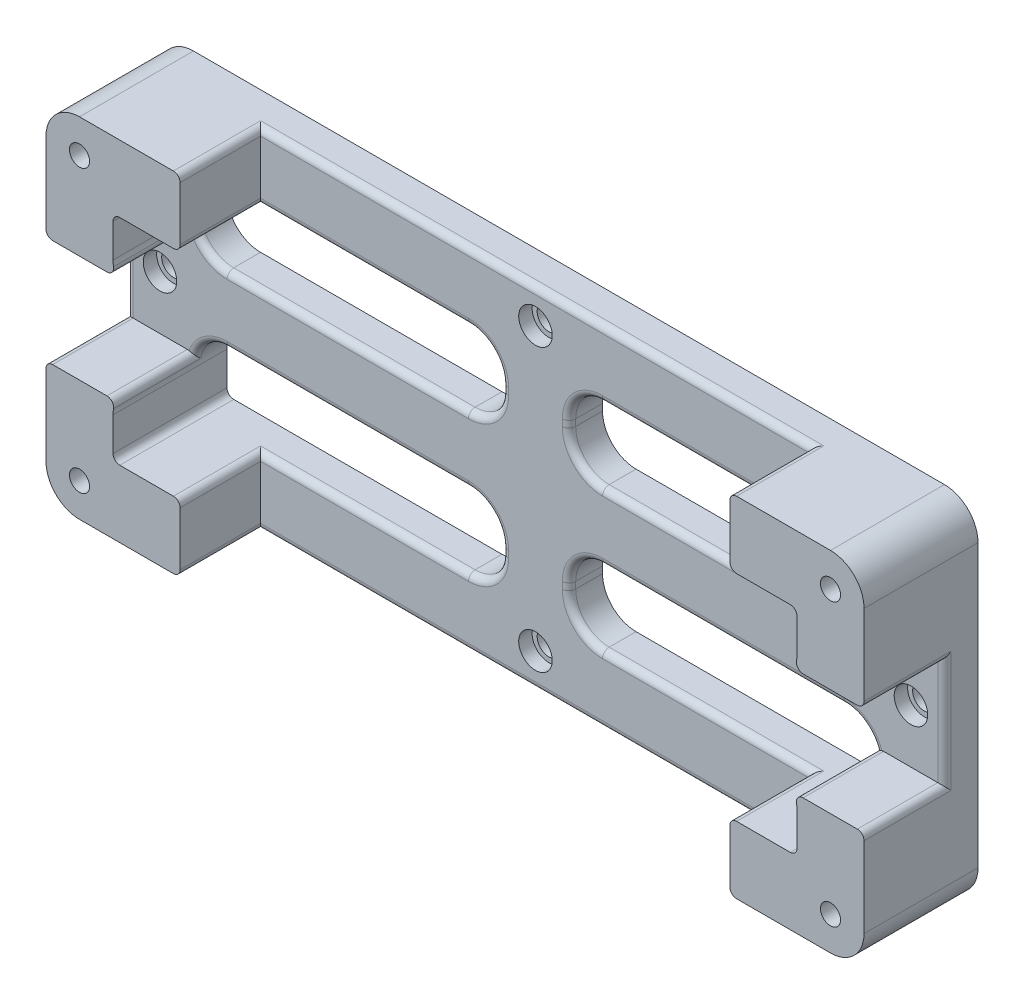
from build123d import *

# Parameters (mm, degrees)
SKETCH1_W           = 122
SKETCH1_H           = 52
SKETCH1_W_2         = 102
SKETCH1_H_2         = 32
BOSS_EXTRUDE1_DEPTH = 5
BOSS_EXTRUDE2_DEPTH = 5
BOSS_EXTRUDE3_DEPTH = 12
SKETCH4_R           = 1.5
CUT_EXTRUDE1_DEPTH  = 7
SKETCH5_R           = 1.75
CUT_EXTRUDE2_DEPTH  = 121.216471417
SKETCH6_R           = 2.5
CUT_EXTRUDE3_DEPTH  = 2
FILLET1_R           = 5
FILLET2_R           = 1


with BuildPart() as part:
    # Sketch1 → Boss-Extrude1 (new body)
    with BuildSketch(Plane.XY):
        with Locations((51, 16)):
            Rectangle(SKETCH1_W, SKETCH1_H)
        with Locations((51, 16)):
            Rectangle(SKETCH1_W_2, SKETCH1_H_2, mode=Mode.SUBTRACT)
    extrude(amount=BOSS_EXTRUDE1_DEPTH)

    # Sketch2 → Boss-Extrude2 (add)
    with BuildSketch(Plane.XY.offset(5)):
        Polygon((51, 32), (56, 32), (56, 21), (102, 21), (102, 16), (102, 11), (56, 11), (56, 0), (51, 0), (46, 0), (46, 11), (0, 11), (0, 16), (0, 21), (46, 21), (46, 32), align=None)
    extrude(amount=-BOSS_EXTRUDE2_DEPTH)

    # Sketch3 → Boss-Extrude3 (add)
    with BuildSketch(Plane.XY.offset(5)):
        Polygon((-10, 42), (10, 42), (10, 32), (0, 32), (0, 24), (-10, 24), align=None)
        Polygon((-10, -10), (10, -10), (10, 0), (0, 0), (0, 8), (-10, 8), align=None)
        Polygon((112, -10), (112, 8), (102, 8), (102, 0), (92, 0), (92, -10), align=None)
        Polygon((112, 42), (92, 42), (92, 32), (102, 32), (102, 24), (112, 24), align=None)
    extrude(amount=BOSS_EXTRUDE3_DEPTH)

    # Sketch4 → Cut-Extrude1 (cut)
    with BuildSketch(Plane.XY.offset(17)):
        with Locations((-5, 37)):
            Circle(SKETCH4_R)
        with Locations((107, 37)):
            Circle(SKETCH4_R)
        with Locations((107, -5)):
            Circle(SKETCH4_R)
        with Locations((-5, -5)):
            Circle(SKETCH4_R)
    extrude(amount=-CUT_EXTRUDE1_DEPTH, mode=Mode.SUBTRACT)

    # Sketch5 → Cut-Extrude2 (cut, through all)
    with BuildSketch(Plane.XY.offset(5)):
        with Locations((-5, 16)):
            Circle(SKETCH5_R)
        with Locations((51, 37)):
            Circle(SKETCH5_R)
        with Locations((107, 16)):
            Circle(SKETCH5_R)
        with Locations((51, -5)):
            Circle(SKETCH5_R)
    extrude(amount=-CUT_EXTRUDE2_DEPTH, mode=Mode.SUBTRACT)

    # Sketch6 → Cut-Extrude3 (cut)
    with BuildSketch(Plane.XY.offset(5)):
        with Locations((-5, 16)):
            Circle(SKETCH6_R)
        with Locations((51, 37)):
            Circle(SKETCH6_R)
        with Locations((51, -5)):
            Circle(SKETCH6_R)
        with Locations((107, 16)):
            Circle(SKETCH6_R)
    extrude(amount=-CUT_EXTRUDE3_DEPTH, mode=Mode.SUBTRACT)

    # Fillet1
    fillet1_edges = [part.edges().sort_by_distance(p)[0] for p in [
        (-10, 42, 8.5),
        (112, 42, 8.5),
        (112, -10, 8.5),
        (-10, -10, 8.5),
        (56, 11, 2.5),
        (56, 0, 2.5),
        (56, 21, 2.5),
        (102, 21, 2.5),
        (56, 32, 2.5),
        (102, 11, 2.5),
        (46, 0, 2.5),
        (46, 11, 2.5),
        (0, 11, 2.5),
        (0, 21, 2.5),
        (46, 32, 2.5),
        (46, 21, 2.5),
    ]]
    fillet(fillet1_edges, radius=FILLET1_R)

    # Fillet2
    # the kernel refuses this fillet: 1 mm, written as the material it adds along each edge
    with BuildSketch(Plane(origin=(0, 32, 0), x_dir=(0, -1, 0), z_dir=(0, 0, 1)), Plane(origin=(102, 0, 0), x_dir=(0, 1, 0), z_dir=(0, 0, 1)), Plane(origin=(102, 32, 0), x_dir=(-1, 0, 0), z_dir=(0, 0, 1))) as fillet2_piece_1:
        with BuildLine():
            CenterArc((FILLET2_R, FILLET2_R), FILLET2_R, 180, 90)
            Line((0, FILLET2_R), (0, 0))
            Line((0, 0), (FILLET2_R, 0))
        make_face()
    extrude(amount=17)
    with BuildSketch(Plane(origin=(0, 0, 17), x_dir=(1, 0, 0), z_dir=(0, 0, -1))) as fillet2_piece_2:
        with BuildLine():
            CenterArc((FILLET2_R, -FILLET2_R), FILLET2_R, 90, 90)
            Line((0, -FILLET2_R), (0, 0))
            Line((0, 0), (FILLET2_R, 0))
        make_face()
    extrude(amount=17)
    # the kernel refuses this fillet: 1 mm, written as the material it takes off along each edge
    with BuildSketch(Plane(origin=(112, 8, 5), x_dir=(-1, 0, 0), z_dir=(0, 1, 0)), Plane(origin=(-10, 24, 5), x_dir=(1, 0, 0), z_dir=(0, -1, 0))) as fillet2_2_piece_1:
        with BuildLine():
            CenterArc((FILLET2_R, -FILLET2_R), FILLET2_R, 90, 90)
            Line((0, -FILLET2_R), (0, 0))
            Line((0, 0), (FILLET2_R, 0))
        make_face()
    extrude(amount=16, mode=Mode.SUBTRACT)
    with BuildSketch(Plane(origin=(92, -10, 5), x_dir=(1, 0, 0), z_dir=(0, 0, 1)), Plane(origin=(92, 0, 5), x_dir=(0, -1, 0), z_dir=(0, 0, 1)), Plane(origin=(112, 24, 5), x_dir=(0, 1, 0), z_dir=(0, 0, 1)), Plane(origin=(92, 32, 5), x_dir=(1, 0, 0), z_dir=(0, 0, 1)), Plane(origin=(10, 42, 5), x_dir=(-1, 0, 0), z_dir=(0, 0, 1)), Plane(origin=(-10, 8, 5), x_dir=(0, -1, 0), z_dir=(0, 0, 1))) as fillet2_2_piece_2:
        with BuildLine():
            CenterArc((FILLET2_R, FILLET2_R), FILLET2_R, 180, 90)
            Line((0, FILLET2_R), (0, 0))
            Line((0, 0), (FILLET2_R, 0))
        make_face()
    extrude(amount=14.5, mode=Mode.SUBTRACT)
    with BuildSketch(Plane(origin=(112, 8, 5), x_dir=(0, -1, 0), z_dir=(0, 0, 1)), Plane(origin=(92, 42, 5), x_dir=(1, 0, 0), z_dir=(0, 0, 1)), Plane(origin=(-10, 24, 5), x_dir=(0, 1, 0), z_dir=(0, 0, 1)), Plane(origin=(10, 32, 5), x_dir=(-1, 0, 0), z_dir=(0, 0, 1)), Plane(origin=(10, -10, 5), x_dir=(-1, 0, 0), z_dir=(0, 0, 1)), Plane(origin=(10, 0, 5), x_dir=(0, -1, 0), z_dir=(0, 0, 1))) as fillet2_2_piece_3:
        with BuildLine():
            CenterArc((FILLET2_R, -FILLET2_R), FILLET2_R, 90, 90)
            Line((0, -FILLET2_R), (0, 0))
            Line((0, 0), (FILLET2_R, 0))
        make_face()
    extrude(amount=14.5, mode=Mode.SUBTRACT)
    with BuildSketch(Plane(origin=(92, 42, 5), x_dir=(0, -1, 0), z_dir=(-1, 0, 0))) as fillet2_2_piece_4:
        with BuildLine():
            CenterArc((FILLET2_R, -FILLET2_R), FILLET2_R, 90, 90)
            Line((0, -FILLET2_R), (0, 0))
            Line((0, 0), (FILLET2_R, 0))
        make_face()
    extrude(amount=82, mode=Mode.SUBTRACT)
    with BuildSketch(Plane(origin=(92, 32, 5), x_dir=(0, 1, 0), z_dir=(-1, 0, 0)), Plane(origin=(61, 0, 5), x_dir=(0, -1, 0), z_dir=(1, 0, 0)), Plane(origin=(41, 32, 5), x_dir=(0, 1, 0), z_dir=(-1, 0, 0)), Plane(origin=(10, 0, 5), x_dir=(0, -1, 0), z_dir=(1, 0, 0))) as fillet2_2_piece_5:
        with BuildLine():
            CenterArc((FILLET2_R, FILLET2_R), FILLET2_R, 180, 90)
            Line((0, FILLET2_R), (0, 0))
            Line((0, 0), (FILLET2_R, 0))
        make_face()
    extrude(amount=31, mode=Mode.SUBTRACT)
    with BuildSketch(Plane(origin=(56, 6, 5), x_dir=(-1, 0, 0), z_dir=(0, -1, 0)), Plane(origin=(56, 27, 5), x_dir=(-1, 0, 0), z_dir=(0, -1, 0)), Plane(origin=(46, 5, 5), x_dir=(1, 0, 0), z_dir=(0, 1, 0)), Plane(origin=(46, 26, 5), x_dir=(1, 0, 0), z_dir=(0, 1, 0))) as fillet2_2_piece_6:
        with BuildLine():
            CenterArc((FILLET2_R, FILLET2_R), FILLET2_R, 180, 90)
            Line((0, FILLET2_R), (0, 0))
            Line((0, 0), (FILLET2_R, 0))
        make_face()
    extrude(amount=1, mode=Mode.SUBTRACT)
    with BuildSketch(Plane(origin=(97, 11, 5), x_dir=(0, 1, 0), z_dir=(-1, 0, 0)), Plane(origin=(61, 21, 5), x_dir=(0, -1, 0), z_dir=(1, 0, 0)), Plane(origin=(41, 11, 5), x_dir=(0, 1, 0), z_dir=(-1, 0, 0)), Plane(origin=(5, 21, 5), x_dir=(0, -1, 0), z_dir=(1, 0, 0))) as fillet2_2_piece_7:
        with BuildLine():
            CenterArc((FILLET2_R, FILLET2_R), FILLET2_R, 180, 90)
            Line((0, FILLET2_R), (0, 0))
            Line((0, 0), (FILLET2_R, 0))
        make_face()
    extrude(amount=36, mode=Mode.SUBTRACT)
    with BuildSketch(Plane(origin=(61, 6, 5), x_dir=(-1, 0, 0), z_dir=(0, -1, 0))) as fillet2_2_piece_8:
        with BuildLine():
            CenterArc((5 + FILLET2_R, FILLET2_R), FILLET2_R, 180, 90)
            Line((5, FILLET2_R), (5, 0))
            Line((5, 0), (5 + FILLET2_R, 0))
        make_face()
    revolve(axis=Axis((61, 6, 5), (0, 0, -1)), revolution_arc=90, mode=Mode.SUBTRACT)
    with BuildSketch(Plane(origin=(61, 5, 5), x_dir=(0, -1, 0), z_dir=(1, 0, 0))) as fillet2_2_piece_9:
        with BuildLine():
            CenterArc((5 + FILLET2_R, FILLET2_R), FILLET2_R, 180, 90)
            Line((5, FILLET2_R), (5, 0))
            Line((5, 0), (5 + FILLET2_R, 0))
        make_face()
    revolve(axis=Axis((61, 5, 5), (0, 0, -1)), revolution_arc=90, mode=Mode.SUBTRACT)
    with BuildSketch(Plane(origin=(61, 26, 5), x_dir=(0, -1, 0), z_dir=(1, 0, 0))) as fillet2_2_piece_10:
        with BuildLine():
            CenterArc((5 + FILLET2_R, FILLET2_R), FILLET2_R, 180, 90)
            Line((5, FILLET2_R), (5, 0))
            Line((5, 0), (5 + FILLET2_R, 0))
        make_face()
    revolve(axis=Axis((61, 26, 5), (0, 0, -1)), revolution_arc=90, mode=Mode.SUBTRACT)
    with BuildSketch(Plane(origin=(101.582575695, 24, 20.33376022), x_dir=(0.28545625982941963, 0.9583917381343596, 0), z_dir=(0, 0, -1)), Plane(origin=(101.582575695, 8, 5), x_dir=(0.2854562598294208, -0.9583917381343592, 0), z_dir=(0, 0, 1))) as fillet2_2_piece_11:
        with BuildLine():
            CenterArc((1.339048828, 0.992563041), FILLET2_R, 163.413876647, 99.594068227)
            Line((0.380657089, 1.278019301), (0, 0))
            ThreePointArc((0, 0), (0.608658558, 0.037184795), (1.217317116, 0))
        make_face()
    extrude(amount=15.33376022, mode=Mode.SUBTRACT)
    with BuildSketch(Plane(origin=(97, 26, 5), x_dir=(0.9960782469793129, 0.08847669690160782, 0), z_dir=(-0.08847669690160782, 0.9960782469793129, 0))) as fillet2_2_piece_12_section:
        with BuildLine():
            CenterArc((5 + FILLET2_R, FILLET2_R), FILLET2_R, 180, 90)
            Line((5, FILLET2_R), (5, 0))
            Line((5, 0), (5 + FILLET2_R, 0))
        make_face()
    fillet2_2_piece_12 = revolve(axis=Axis((97, 26, 5), (0, 0, -1)), revolution_arc=95.075978632, mode=Mode.PRIVATE)
    fillet2_2_piece_12 = split(fillet2_2_piece_12, bisect_by=Plane(origin=(100.051108418, 24, 4.715325201), z_dir=(0, -1, 0)), keep=Keep.TOP, mode=Mode.PRIVATE)
    add(fillet2_2_piece_12, mode=Mode.SUBTRACT)
    with BuildSketch(Plane(origin=(61, 27, 5), x_dir=(-1, 0, 0), z_dir=(0, -1, 0))) as fillet2_2_piece_13:
        with BuildLine():
            CenterArc((5 + FILLET2_R, FILLET2_R), FILLET2_R, 180, 90)
            Line((5, FILLET2_R), (5, 0))
            Line((5, 0), (5 + FILLET2_R, 0))
        make_face()
    revolve(axis=Axis((61, 27, 5), (0, 0, -1)), revolution_arc=90, mode=Mode.SUBTRACT)
    with BuildSketch(Plane(origin=(97, 6, 5), x_dir=(0, 1, 0), z_dir=(-1, 0, 0))) as fillet2_2_piece_14_section:
        with BuildLine():
            CenterArc((5 + FILLET2_R, FILLET2_R), FILLET2_R, 180, 90)
            Line((5, FILLET2_R), (5, 0))
            Line((5, 0), (5 + FILLET2_R, 0))
        make_face()
    fillet2_2_piece_14 = revolve(axis=Axis((97, 6, 5), (0, 0, -1)), revolution_arc=95.075978632, mode=Mode.PRIVATE)
    fillet2_2_piece_14 = split(fillet2_2_piece_14, bisect_by=Plane(origin=(100.051108415, 8, 4.715325206), z_dir=(0, 1, 0)), keep=Keep.TOP, mode=Mode.PRIVATE)
    add(fillet2_2_piece_14, mode=Mode.SUBTRACT)
    with BuildSketch(Plane(origin=(41, 5, 5), x_dir=(0, -1, 0), z_dir=(-1, 0, 0))) as fillet2_2_piece_15:
        with BuildLine():
            CenterArc((5 + FILLET2_R, -FILLET2_R), FILLET2_R, 90, 90)
            Line((5, -FILLET2_R), (5, 0))
            Line((5, 0), (5 + FILLET2_R, 0))
        make_face()
    revolve(axis=Axis((41, 5, 5), (0, 0, 1)), revolution_arc=90, mode=Mode.SUBTRACT)
    with BuildSketch(Plane(origin=(41, 6, 5), x_dir=(1, 0, 0), z_dir=(0, -1, 0))) as fillet2_2_piece_16:
        with BuildLine():
            CenterArc((5 + FILLET2_R, -FILLET2_R), FILLET2_R, 90, 90)
            Line((5, -FILLET2_R), (5, 0))
            Line((5, 0), (5 + FILLET2_R, 0))
        make_face()
    revolve(axis=Axis((41, 6, 5), (0, 0, 1)), revolution_arc=90, mode=Mode.SUBTRACT)
    with BuildSketch(Plane(origin=(0.417424305, 8, 20.33376022), x_dir=(-1, 0, 0), z_dir=(0, 0, -1))) as fillet2_2_piece_17:
        with BuildLine():
            CenterArc((1.333504088, -1), FILLET2_R, 90, 99.594068227)
            ThreePointArc((0.347490791, -1.166666667), (0.209382996, -0.572718701), (0, 0))
            Line((0, 0), (1.333504088, 0))
        make_face()
    extrude(amount=15.33376022, mode=Mode.SUBTRACT)
    with BuildSketch(Plane(origin=(5, 6, 5), x_dir=(-0.9960782469793135, -0.08847669690160202, 0), z_dir=(0.08847669690160202, -0.9960782469793135, 0))) as fillet2_2_piece_18_section:
        with BuildLine():
            CenterArc((5 + FILLET2_R, FILLET2_R), FILLET2_R, 180, 90)
            Line((5, FILLET2_R), (5, 0))
            Line((5, 0), (5 + FILLET2_R, 0))
        make_face()
    fillet2_2_piece_18 = revolve(axis=Axis((5, 6, 5), (0, 0, -1)), revolution_arc=95.075978632, mode=Mode.PRIVATE)
    fillet2_2_piece_18 = split(fillet2_2_piece_18, bisect_by=Plane(origin=(1.948891582, 8, 4.715325201), z_dir=(0, 1, 0)), keep=Keep.TOP, mode=Mode.PRIVATE)
    add(fillet2_2_piece_18, mode=Mode.SUBTRACT)
    with BuildSketch(Plane(origin=(5, 26, 5), x_dir=(-0.9960782469793129, 0.08847669690160771, 0), z_dir=(0.08847669690160771, 0.9960782469793129, 0))) as fillet2_2_piece_19_section:
        with BuildLine():
            CenterArc((5 + FILLET2_R, -FILLET2_R), FILLET2_R, 90, 90)
            Line((5, -FILLET2_R), (5, 0))
            Line((5, 0), (5 + FILLET2_R, 0))
        make_face()
    fillet2_2_piece_19 = revolve(axis=Axis((5, 26, 5), (0, 0, 1)), revolution_arc=95.075978632, mode=Mode.PRIVATE)
    fillet2_2_piece_19 = split(fillet2_2_piece_19, bisect_by=Plane(origin=(1.948891582, 24, 4.715325201), z_dir=(0, -1, 0)), keep=Keep.TOP, mode=Mode.PRIVATE)
    add(fillet2_2_piece_19, mode=Mode.SUBTRACT)
    with BuildSketch(Plane(origin=(0.417424305, 24, 20.33376022), x_dir=(-0.28545625982941775, 0.9583917381343602, 0), z_dir=(0, 0, -1))) as fillet2_2_piece_20:
        with BuildLine():
            CenterArc((1.339048828, -0.992563041), FILLET2_R, 96.992055126, 99.594068227)
            Line((0.380657089, -1.278019301), (0, 0))
            ThreePointArc((0, 0), (0.608658558, -0.037184795), (1.217317116, 0))
        make_face()
    extrude(amount=15.33376022, mode=Mode.SUBTRACT)
    with BuildSketch(Plane(origin=(41, 27, 5), x_dir=(1, 0, 0), z_dir=(0, -1, 0))) as fillet2_2_piece_21:
        with BuildLine():
            CenterArc((5 + FILLET2_R, -FILLET2_R), FILLET2_R, 90, 90)
            Line((5, -FILLET2_R), (5, 0))
            Line((5, 0), (5 + FILLET2_R, 0))
        make_face()
    revolve(axis=Axis((41, 27, 5), (0, 0, 1)), revolution_arc=90, mode=Mode.SUBTRACT)
    with BuildSketch(Plane(origin=(41, 26, 5), x_dir=(0, -1, 0), z_dir=(-1, 0, 0))) as fillet2_2_piece_22:
        with BuildLine():
            CenterArc((5 + FILLET2_R, -FILLET2_R), FILLET2_R, 90, 90)
            Line((5, -FILLET2_R), (5, 0))
            Line((5, 0), (5 + FILLET2_R, 0))
        make_face()
    revolve(axis=Axis((41, 26, 5), (0, 0, 1)), revolution_arc=90, mode=Mode.SUBTRACT)
    with BuildSketch(Plane(origin=(10, -10, 5), x_dir=(0, 0, -1), z_dir=(1, 0, 0))) as fillet2_2_piece_23:
        with BuildLine():
            CenterArc((FILLET2_R, FILLET2_R), FILLET2_R, 180, 90)
            Line((0, FILLET2_R), (0, 0))
            Line((0, 0), (FILLET2_R, 0))
        make_face()
    extrude(amount=82, mode=Mode.SUBTRACT)
    with BuildSketch(Plane(origin=(112, 5.5, 5), x_dir=(-1, 0, 0), z_dir=(0, 1, 0))) as fillet2_2_piece_24a_section:
        with BuildLine():
            CenterArc((FILLET2_R, -FILLET2_R), FILLET2_R, 90, 90)
            Line((0, -FILLET2_R), (0, 0))
            Line((0, 0), (FILLET2_R, 0))
        make_face()
    fillet2_2_piece_24a = extrude(amount=18.5, mode=Mode.PRIVATE)
    fillet2_2_piece_24a = split(fillet2_2_piece_24a, bisect_by=Plane(origin=(111.773604886, 8, 4.773604886), z_dir=(0, -1, 0)), keep=Keep.TOP, mode=Mode.PRIVATE)
    with BuildSketch(Plane(origin=(112, 8, 2.5), x_dir=(0, -1, 0), z_dir=(0, 0, 1))) as fillet2_2_piece_24b_section:
        with BuildLine():
            CenterArc((FILLET2_R, -FILLET2_R), FILLET2_R, 90, 90)
            Line((0, -FILLET2_R), (0, 0))
            Line((0, 0), (FILLET2_R, 0))
        make_face()
    fillet2_2_piece_24b = extrude(amount=17, mode=Mode.PRIVATE)
    fillet2_2_piece_24b = split(fillet2_2_piece_24b, bisect_by=Plane(origin=(111.773604886, 7.773604886, 5), z_dir=(0, 0, -1)), keep=Keep.TOP, mode=Mode.PRIVATE)
    fillet2_2_piece_24 = fillet2_2_piece_24a & fillet2_2_piece_24b
    add(fillet2_2_piece_24, mode=Mode.SUBTRACT)
    with BuildSketch(Plane(origin=(112, 8, 5), x_dir=(-1, 0, 0), z_dir=(0, 1, 0))) as fillet2_2_piece_25a_section:
        with BuildLine():
            CenterArc((FILLET2_R, -FILLET2_R), FILLET2_R, 90, 90)
            Line((0, -FILLET2_R), (0, 0))
            Line((0, 0), (FILLET2_R, 0))
        make_face()
    fillet2_2_piece_25a = extrude(amount=18.5, mode=Mode.PRIVATE)
    fillet2_2_piece_25a = split(fillet2_2_piece_25a, bisect_by=Plane(origin=(111.773604886, 24, 4.773604886), z_dir=(0, 1, 0)), keep=Keep.TOP, mode=Mode.PRIVATE)
    with BuildSketch(Plane(origin=(112, 24, 2.5), x_dir=(0, 1, 0), z_dir=(0, 0, 1))) as fillet2_2_piece_25b_section:
        with BuildLine():
            CenterArc((FILLET2_R, FILLET2_R), FILLET2_R, 180, 90)
            Line((0, FILLET2_R), (0, 0))
            Line((0, 0), (FILLET2_R, 0))
        make_face()
    fillet2_2_piece_25b = extrude(amount=17, mode=Mode.PRIVATE)
    fillet2_2_piece_25b = split(fillet2_2_piece_25b, bisect_by=Plane(origin=(111.773604886, 24.226395114, 5), z_dir=(0, 0, -1)), keep=Keep.TOP, mode=Mode.PRIVATE)
    fillet2_2_piece_25 = fillet2_2_piece_25a & fillet2_2_piece_25b
    add(fillet2_2_piece_25, mode=Mode.SUBTRACT)
    with BuildSketch(Plane(origin=(10, -10, 5), x_dir=(0, 0, -1), z_dir=(1, 0, 0))) as fillet2_2_piece_26a_section:
        with BuildLine():
            CenterArc((FILLET2_R, FILLET2_R), FILLET2_R, 180, 90)
            Line((0, FILLET2_R), (0, 0))
            Line((0, 0), (FILLET2_R, 0))
        make_face()
    fillet2_2_piece_26a = extrude(amount=84.5, mode=Mode.PRIVATE)
    fillet2_2_piece_26a = split(fillet2_2_piece_26a, bisect_by=Plane(origin=(92, -9.773604886, 4.773604886), z_dir=(1, 0, 0)), keep=Keep.TOP, mode=Mode.PRIVATE)
    with BuildSketch(Plane(origin=(92, -10, 2.5), x_dir=(1, 0, 0), z_dir=(0, 0, 1))) as fillet2_2_piece_26b_section:
        with BuildLine():
            CenterArc((FILLET2_R, FILLET2_R), FILLET2_R, 180, 90)
            Line((0, FILLET2_R), (0, 0))
            Line((0, 0), (FILLET2_R, 0))
        make_face()
    fillet2_2_piece_26b = extrude(amount=17, mode=Mode.PRIVATE)
    fillet2_2_piece_26b = split(fillet2_2_piece_26b, bisect_by=Plane(origin=(92.226395114, -9.773604886, 5), z_dir=(0, 0, -1)), keep=Keep.TOP, mode=Mode.PRIVATE)
    fillet2_2_piece_26 = fillet2_2_piece_26a & fillet2_2_piece_26b
    add(fillet2_2_piece_26, mode=Mode.SUBTRACT)
    with BuildSketch(Plane(origin=(61, 0, 5), x_dir=(0, -1, 0), z_dir=(1, 0, 0))) as fillet2_2_piece_27a_section:
        with BuildLine():
            CenterArc((FILLET2_R, FILLET2_R), FILLET2_R, 180, 90)
            Line((0, FILLET2_R), (0, 0))
            Line((0, 0), (FILLET2_R, 0))
        make_face()
    fillet2_2_piece_27a = extrude(amount=33.5, mode=Mode.PRIVATE)
    fillet2_2_piece_27a = split(fillet2_2_piece_27a, bisect_by=Plane(origin=(92, -0.226395114, 4.773604886), z_dir=(1, 0, 0)), keep=Keep.TOP, mode=Mode.PRIVATE)
    with BuildSketch(Plane(origin=(92, 0, 2.5), x_dir=(0, -1, 0), z_dir=(0, 0, 1))) as fillet2_2_piece_27b_section:
        with BuildLine():
            CenterArc((FILLET2_R, FILLET2_R), FILLET2_R, 180, 90)
            Line((0, FILLET2_R), (0, 0))
            Line((0, 0), (FILLET2_R, 0))
        make_face()
    fillet2_2_piece_27b = extrude(amount=17, mode=Mode.PRIVATE)
    fillet2_2_piece_27b = split(fillet2_2_piece_27b, bisect_by=Plane(origin=(92.226395114, -0.226395114, 5), z_dir=(0, 0, -1)), keep=Keep.TOP, mode=Mode.PRIVATE)
    fillet2_2_piece_27 = fillet2_2_piece_27a & fillet2_2_piece_27b
    add(fillet2_2_piece_27, mode=Mode.SUBTRACT)
    with BuildSketch(Plane(origin=(94.5, 42, 5), x_dir=(0, -1, 0), z_dir=(-1, 0, 0))) as fillet2_2_piece_28a_section:
        with BuildLine():
            CenterArc((FILLET2_R, -FILLET2_R), FILLET2_R, 90, 90)
            Line((0, -FILLET2_R), (0, 0))
            Line((0, 0), (FILLET2_R, 0))
        make_face()
    fillet2_2_piece_28a = extrude(amount=84.5, mode=Mode.PRIVATE)
    fillet2_2_piece_28a = split(fillet2_2_piece_28a, bisect_by=Plane(origin=(92, 41.773604886, 4.773604886), z_dir=(1, 0, 0)), keep=Keep.TOP, mode=Mode.PRIVATE)
    with BuildSketch(Plane(origin=(92, 42, 2.5), x_dir=(1, 0, 0), z_dir=(0, 0, 1))) as fillet2_2_piece_28b_section:
        with BuildLine():
            CenterArc((FILLET2_R, -FILLET2_R), FILLET2_R, 90, 90)
            Line((0, -FILLET2_R), (0, 0))
            Line((0, 0), (FILLET2_R, 0))
        make_face()
    fillet2_2_piece_28b = extrude(amount=17, mode=Mode.PRIVATE)
    fillet2_2_piece_28b = split(fillet2_2_piece_28b, bisect_by=Plane(origin=(92.226395114, 41.773604886, 5), z_dir=(0, 0, -1)), keep=Keep.TOP, mode=Mode.PRIVATE)
    fillet2_2_piece_28 = fillet2_2_piece_28a & fillet2_2_piece_28b
    add(fillet2_2_piece_28, mode=Mode.SUBTRACT)
    with BuildSketch(Plane(origin=(92, 42, 5), x_dir=(0, -1, 0), z_dir=(-1, 0, 0))) as fillet2_2_piece_29a_section:
        with BuildLine():
            CenterArc((FILLET2_R, -FILLET2_R), FILLET2_R, 90, 90)
            Line((0, -FILLET2_R), (0, 0))
            Line((0, 0), (FILLET2_R, 0))
        make_face()
    fillet2_2_piece_29a = extrude(amount=84.5, mode=Mode.PRIVATE)
    fillet2_2_piece_29a = split(fillet2_2_piece_29a, bisect_by=Plane(origin=(10, 41.773604886, 4.773604886), z_dir=(-1, 0, 0)), keep=Keep.TOP, mode=Mode.PRIVATE)
    with BuildSketch(Plane(origin=(10, 42, 2.5), x_dir=(-1, 0, 0), z_dir=(0, 0, 1))) as fillet2_2_piece_29b_section:
        with BuildLine():
            CenterArc((FILLET2_R, FILLET2_R), FILLET2_R, 180, 90)
            Line((0, FILLET2_R), (0, 0))
            Line((0, 0), (FILLET2_R, 0))
        make_face()
    fillet2_2_piece_29b = extrude(amount=17, mode=Mode.PRIVATE)
    fillet2_2_piece_29b = split(fillet2_2_piece_29b, bisect_by=Plane(origin=(9.773604886, 41.773604886, 5), z_dir=(0, 0, -1)), keep=Keep.TOP, mode=Mode.PRIVATE)
    fillet2_2_piece_29 = fillet2_2_piece_29a & fillet2_2_piece_29b
    add(fillet2_2_piece_29, mode=Mode.SUBTRACT)
    with BuildSketch(Plane(origin=(94.5, 32, 5), x_dir=(0, 1, 0), z_dir=(-1, 0, 0))) as fillet2_2_piece_30a_section:
        with BuildLine():
            CenterArc((FILLET2_R, FILLET2_R), FILLET2_R, 180, 90)
            Line((0, FILLET2_R), (0, 0))
            Line((0, 0), (FILLET2_R, 0))
        make_face()
    fillet2_2_piece_30a = extrude(amount=33.5, mode=Mode.PRIVATE)
    fillet2_2_piece_30a = split(fillet2_2_piece_30a, bisect_by=Plane(origin=(92, 32.226395114, 4.773604886), z_dir=(1, 0, 0)), keep=Keep.TOP, mode=Mode.PRIVATE)
    with BuildSketch(Plane(origin=(92, 32, 2.5), x_dir=(1, 0, 0), z_dir=(0, 0, 1))) as fillet2_2_piece_30b_section:
        with BuildLine():
            CenterArc((FILLET2_R, FILLET2_R), FILLET2_R, 180, 90)
            Line((0, FILLET2_R), (0, 0))
            Line((0, 0), (FILLET2_R, 0))
        make_face()
    fillet2_2_piece_30b = extrude(amount=17, mode=Mode.PRIVATE)
    fillet2_2_piece_30b = split(fillet2_2_piece_30b, bisect_by=Plane(origin=(92.226395114, 32.226395114, 5), z_dir=(0, 0, -1)), keep=Keep.TOP, mode=Mode.PRIVATE)
    fillet2_2_piece_30 = fillet2_2_piece_30a & fillet2_2_piece_30b
    add(fillet2_2_piece_30, mode=Mode.SUBTRACT)
    with BuildSketch(Plane(origin=(41, 32, 5), x_dir=(0, 1, 0), z_dir=(-1, 0, 0))) as fillet2_2_piece_31a_section:
        with BuildLine():
            CenterArc((FILLET2_R, FILLET2_R), FILLET2_R, 180, 90)
            Line((0, FILLET2_R), (0, 0))
            Line((0, 0), (FILLET2_R, 0))
        make_face()
    fillet2_2_piece_31a = extrude(amount=33.5, mode=Mode.PRIVATE)
    fillet2_2_piece_31a = split(fillet2_2_piece_31a, bisect_by=Plane(origin=(10, 32.226395114, 4.773604886), z_dir=(-1, 0, 0)), keep=Keep.TOP, mode=Mode.PRIVATE)
    with BuildSketch(Plane(origin=(10, 32, 2.5), x_dir=(-1, 0, 0), z_dir=(0, 0, 1))) as fillet2_2_piece_31b_section:
        with BuildLine():
            CenterArc((FILLET2_R, -FILLET2_R), FILLET2_R, 90, 90)
            Line((0, -FILLET2_R), (0, 0))
            Line((0, 0), (FILLET2_R, 0))
        make_face()
    fillet2_2_piece_31b = extrude(amount=17, mode=Mode.PRIVATE)
    fillet2_2_piece_31b = split(fillet2_2_piece_31b, bisect_by=Plane(origin=(9.773604886, 32.226395114, 5), z_dir=(0, 0, -1)), keep=Keep.TOP, mode=Mode.PRIVATE)
    fillet2_2_piece_31 = fillet2_2_piece_31a & fillet2_2_piece_31b
    add(fillet2_2_piece_31, mode=Mode.SUBTRACT)
    with BuildSketch(Plane(origin=(97, 26, 5), x_dir=(0.9960782469793129, 0.08847669690160782, 0), z_dir=(-0.08847669690160782, 0.9960782469793129, 0))) as fillet2_2_piece_32a_section:
        with BuildLine():
            CenterArc((5 + FILLET2_R, FILLET2_R), FILLET2_R, 180, 90)
            Line((5, FILLET2_R), (5, 0))
            Line((5, 0), (5 + FILLET2_R, 0))
        make_face()
    fillet2_2_piece_32a = revolve(axis=Axis((97, 26, 5), (0, 0, -1)), revolution_arc=95.075978632, mode=Mode.PRIVATE)
    fillet2_2_piece_32a = split(fillet2_2_piece_32a, bisect_by=Plane(origin=(102.117412409, 24, 4.774344712), z_dir=(0, 1, 0)), keep=Keep.TOP, mode=Mode.PRIVATE)
    with BuildSketch(Plane(origin=(101.582575695, 24, 20.33376022), x_dir=(0.28545625982941963, 0.9583917381343596, 0), z_dir=(0, 0, -1))) as fillet2_2_piece_32b_section:
        with BuildLine():
            CenterArc((1.339048828, 0.992563041), FILLET2_R, 163.413876647, 99.594068227)
            Line((0.380657089, 1.278019301), (0, 0))
            ThreePointArc((0, 0), (0.608658558, 0.037184795), (1.217317116, 0))
        make_face()
    fillet2_2_piece_32b = extrude(amount=18.667520441, mode=Mode.PRIVATE)
    fillet2_2_piece_32b = split(fillet2_2_piece_32b, bisect_by=Plane(origin=(102.003252364, 24.270753298, 5), z_dir=(0, 0, -1)), keep=Keep.TOP, mode=Mode.PRIVATE)
    fillet2_2_piece_32 = fillet2_2_piece_32a & fillet2_2_piece_32b
    add(fillet2_2_piece_32, mode=Mode.SUBTRACT)
    with BuildSketch(Plane(origin=(97, 6, 5), x_dir=(0, 1, 0), z_dir=(-1, 0, 0))) as fillet2_2_piece_33a_section:
        with BuildLine():
            CenterArc((5 + FILLET2_R, FILLET2_R), FILLET2_R, 180, 90)
            Line((5, FILLET2_R), (5, 0))
            Line((5, 0), (5 + FILLET2_R, 0))
        make_face()
    fillet2_2_piece_33a = revolve(axis=Axis((97, 6, 5), (0, 0, -1)), revolution_arc=95.075978632, mode=Mode.PRIVATE)
    fillet2_2_piece_33a = split(fillet2_2_piece_33a, bisect_by=Plane(origin=(102.117412014, 8, 4.774344614), z_dir=(0, -1, 0)), keep=Keep.TOP, mode=Mode.PRIVATE)
    with BuildSketch(Plane(origin=(101.582575695, 8, 1.66623978), x_dir=(0.2854562598294208, -0.9583917381343592, 0), z_dir=(0, 0, 1))) as fillet2_2_piece_33b_section:
        with BuildLine():
            CenterArc((1.339048828, 0.992563041), FILLET2_R, 163.413876647, 99.594068227)
            Line((0.380657089, 1.278019301), (0, 0))
            ThreePointArc((0, 0), (0.608658558, 0.037184795), (1.217317116, 0))
        make_face()
    fillet2_2_piece_33b = extrude(amount=18.667520441, mode=Mode.PRIVATE)
    fillet2_2_piece_33b = split(fillet2_2_piece_33b, bisect_by=Plane(origin=(102.003252364, 7.729246702, 5), z_dir=(0, 0, -1)), keep=Keep.TOP, mode=Mode.PRIVATE)
    fillet2_2_piece_33 = fillet2_2_piece_33a & fillet2_2_piece_33b
    add(fillet2_2_piece_33, mode=Mode.SUBTRACT)
    with BuildSketch(Plane(origin=(5, 6, 5), x_dir=(-0.9960782469793135, -0.08847669690160202, 0), z_dir=(0.08847669690160202, -0.9960782469793135, 0))) as fillet2_2_piece_34a_section:
        with BuildLine():
            CenterArc((5 + FILLET2_R, FILLET2_R), FILLET2_R, 180, 90)
            Line((5, FILLET2_R), (5, 0))
            Line((5, 0), (5 + FILLET2_R, 0))
        make_face()
    fillet2_2_piece_34a = revolve(axis=Axis((5, 6, 5), (0, 0, -1)), revolution_arc=95.075978632, mode=Mode.PRIVATE)
    fillet2_2_piece_34a = split(fillet2_2_piece_34a, bisect_by=Plane(origin=(-0.117412409, 8, 4.774344712), z_dir=(0, -1, 0)), keep=Keep.TOP, mode=Mode.PRIVATE)
    with BuildSketch(Plane(origin=(0.417424305, 8, 20.33376022), x_dir=(-1, 0, 0), z_dir=(0, 0, -1))) as fillet2_2_piece_34b_section:
        with BuildLine():
            CenterArc((1.333504088, -1), FILLET2_R, 90, 99.594068227)
            ThreePointArc((0.347490791, -1.166666667), (0.209382996, -0.572718701), (0, 0))
            Line((0, 0), (1.333504088, 0))
        make_face()
    fillet2_2_piece_34b = extrude(amount=18.667520441, mode=Mode.PRIVATE)
    fillet2_2_piece_34b = split(fillet2_2_piece_34b, bisect_by=Plane(origin=(-0.003252364, 7.729246702, 5), z_dir=(0, 0, -1)), keep=Keep.TOP, mode=Mode.PRIVATE)
    fillet2_2_piece_34 = fillet2_2_piece_34a & fillet2_2_piece_34b
    add(fillet2_2_piece_34, mode=Mode.SUBTRACT)
    with BuildSketch(Plane(origin=(5, 26, 5), x_dir=(-0.9960782469793129, 0.08847669690160771, 0), z_dir=(0.08847669690160771, 0.9960782469793129, 0))) as fillet2_2_piece_35a_section:
        with BuildLine():
            CenterArc((5 + FILLET2_R, -FILLET2_R), FILLET2_R, 90, 90)
            Line((5, -FILLET2_R), (5, 0))
            Line((5, 0), (5 + FILLET2_R, 0))
        make_face()
    fillet2_2_piece_35a = revolve(axis=Axis((5, 26, 5), (0, 0, 1)), revolution_arc=95.075978632, mode=Mode.PRIVATE)
    fillet2_2_piece_35a = split(fillet2_2_piece_35a, bisect_by=Plane(origin=(-0.117412409, 24, 4.774344712), z_dir=(0, 1, 0)), keep=Keep.TOP, mode=Mode.PRIVATE)
    with BuildSketch(Plane(origin=(0.417424305, 24, 20.33376022), x_dir=(-0.28545625982941775, 0.9583917381343602, 0), z_dir=(0, 0, -1))) as fillet2_2_piece_35b_section:
        with BuildLine():
            CenterArc((1.339048828, -0.992563041), FILLET2_R, 96.992055126, 99.594068227)
            Line((0.380657089, -1.278019301), (0, 0))
            ThreePointArc((0, 0), (0.608658558, -0.037184795), (1.217317116, 0))
        make_face()
    fillet2_2_piece_35b = extrude(amount=18.667520441, mode=Mode.PRIVATE)
    fillet2_2_piece_35b = split(fillet2_2_piece_35b, bisect_by=Plane(origin=(-0.003252364, 24.270753298, 5), z_dir=(0, 0, -1)), keep=Keep.TOP, mode=Mode.PRIVATE)
    fillet2_2_piece_35 = fillet2_2_piece_35a & fillet2_2_piece_35b
    add(fillet2_2_piece_35, mode=Mode.SUBTRACT)
    with BuildSketch(Plane(origin=(-10, 26.5, 5), x_dir=(1, 0, 0), z_dir=(0, -1, 0))) as fillet2_2_piece_36a_section:
        with BuildLine():
            CenterArc((FILLET2_R, -FILLET2_R), FILLET2_R, 90, 90)
            Line((0, -FILLET2_R), (0, 0))
            Line((0, 0), (FILLET2_R, 0))
        make_face()
    fillet2_2_piece_36a = extrude(amount=18.5, mode=Mode.PRIVATE)
    fillet2_2_piece_36a = split(fillet2_2_piece_36a, bisect_by=Plane(origin=(-9.773604886, 24, 4.773604886), z_dir=(0, 1, 0)), keep=Keep.TOP, mode=Mode.PRIVATE)
    with BuildSketch(Plane(origin=(-10, 24, 2.5), x_dir=(0, 1, 0), z_dir=(0, 0, 1))) as fillet2_2_piece_36b_section:
        with BuildLine():
            CenterArc((FILLET2_R, -FILLET2_R), FILLET2_R, 90, 90)
            Line((0, -FILLET2_R), (0, 0))
            Line((0, 0), (FILLET2_R, 0))
        make_face()
    fillet2_2_piece_36b = extrude(amount=17, mode=Mode.PRIVATE)
    fillet2_2_piece_36b = split(fillet2_2_piece_36b, bisect_by=Plane(origin=(-9.773604886, 24.226395114, 5), z_dir=(0, 0, -1)), keep=Keep.TOP, mode=Mode.PRIVATE)
    fillet2_2_piece_36 = fillet2_2_piece_36a & fillet2_2_piece_36b
    add(fillet2_2_piece_36, mode=Mode.SUBTRACT)
    with BuildSketch(Plane(origin=(-10, 24, 5), x_dir=(1, 0, 0), z_dir=(0, -1, 0))) as fillet2_2_piece_37a_section:
        with BuildLine():
            CenterArc((FILLET2_R, -FILLET2_R), FILLET2_R, 90, 90)
            Line((0, -FILLET2_R), (0, 0))
            Line((0, 0), (FILLET2_R, 0))
        make_face()
    fillet2_2_piece_37a = extrude(amount=18.5, mode=Mode.PRIVATE)
    fillet2_2_piece_37a = split(fillet2_2_piece_37a, bisect_by=Plane(origin=(-9.773604886, 8, 4.773604886), z_dir=(0, -1, 0)), keep=Keep.TOP, mode=Mode.PRIVATE)
    with BuildSketch(Plane(origin=(-10, 8, 2.5), x_dir=(0, -1, 0), z_dir=(0, 0, 1))) as fillet2_2_piece_37b_section:
        with BuildLine():
            CenterArc((FILLET2_R, FILLET2_R), FILLET2_R, 180, 90)
            Line((0, FILLET2_R), (0, 0))
            Line((0, 0), (FILLET2_R, 0))
        make_face()
    fillet2_2_piece_37b = extrude(amount=17, mode=Mode.PRIVATE)
    fillet2_2_piece_37b = split(fillet2_2_piece_37b, bisect_by=Plane(origin=(-9.773604886, 7.773604886, 5), z_dir=(0, 0, -1)), keep=Keep.TOP, mode=Mode.PRIVATE)
    fillet2_2_piece_37 = fillet2_2_piece_37a & fillet2_2_piece_37b
    add(fillet2_2_piece_37, mode=Mode.SUBTRACT)
    with BuildSketch(Plane(origin=(10, 0, 2.5), x_dir=(0, -1, 0), z_dir=(0, 0, 1))) as fillet2_2_piece_38a_section:
        with BuildLine():
            CenterArc((FILLET2_R, -FILLET2_R), FILLET2_R, 90, 90)
            Line((0, -FILLET2_R), (0, 0))
            Line((0, 0), (FILLET2_R, 0))
        make_face()
    fillet2_2_piece_38a = extrude(amount=17, mode=Mode.PRIVATE)
    fillet2_2_piece_38a = split(fillet2_2_piece_38a, bisect_by=Plane(origin=(9.773604886, -0.226395114, 5), z_dir=(0, 0, -1)), keep=Keep.TOP, mode=Mode.PRIVATE)
    with BuildSketch(Plane(origin=(7.5, 0, 5), x_dir=(0, -1, 0), z_dir=(1, 0, 0))) as fillet2_2_piece_38b_section:
        with BuildLine():
            CenterArc((FILLET2_R, FILLET2_R), FILLET2_R, 180, 90)
            Line((0, FILLET2_R), (0, 0))
            Line((0, 0), (FILLET2_R, 0))
        make_face()
    fillet2_2_piece_38b = extrude(amount=33.5, mode=Mode.PRIVATE)
    fillet2_2_piece_38b = split(fillet2_2_piece_38b, bisect_by=Plane(origin=(10, -0.226395114, 4.773604886), z_dir=(-1, 0, 0)), keep=Keep.TOP, mode=Mode.PRIVATE)
    fillet2_2_piece_38 = fillet2_2_piece_38a & fillet2_2_piece_38b
    add(fillet2_2_piece_38, mode=Mode.SUBTRACT)
    with BuildSketch(Plane(origin=(10, -10, 2.5), x_dir=(-1, 0, 0), z_dir=(0, 0, 1))) as fillet2_2_piece_39a_section:
        with BuildLine():
            CenterArc((FILLET2_R, -FILLET2_R), FILLET2_R, 90, 90)
            Line((0, -FILLET2_R), (0, 0))
            Line((0, 0), (FILLET2_R, 0))
        make_face()
    fillet2_2_piece_39a = extrude(amount=17, mode=Mode.PRIVATE)
    fillet2_2_piece_39a = split(fillet2_2_piece_39a, bisect_by=Plane(origin=(9.773604886, -9.773604886, 5), z_dir=(0, 0, -1)), keep=Keep.TOP, mode=Mode.PRIVATE)
    with BuildSketch(Plane(origin=(7.5, -10, 5), x_dir=(0, 0, -1), z_dir=(1, 0, 0))) as fillet2_2_piece_39b_section:
        with BuildLine():
            CenterArc((FILLET2_R, FILLET2_R), FILLET2_R, 180, 90)
            Line((0, FILLET2_R), (0, 0))
            Line((0, 0), (FILLET2_R, 0))
        make_face()
    fillet2_2_piece_39b = extrude(amount=84.5, mode=Mode.PRIVATE)
    fillet2_2_piece_39b = split(fillet2_2_piece_39b, bisect_by=Plane(origin=(10, -9.773604886, 4.773604886), z_dir=(-1, 0, 0)), keep=Keep.TOP, mode=Mode.PRIVATE)
    fillet2_2_piece_39 = fillet2_2_piece_39a & fillet2_2_piece_39b
    add(fillet2_2_piece_39, mode=Mode.SUBTRACT)


solid = part.part
